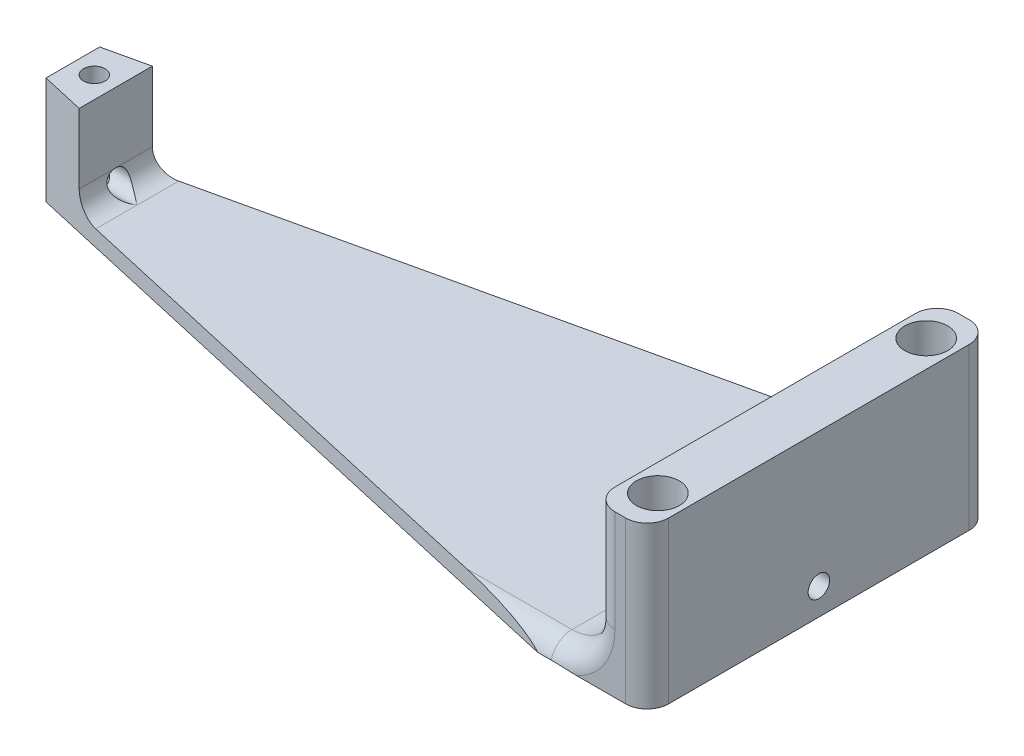
from build123d import *

# Parameters (mm, degrees)
BOSS_EXTRUDE1_DEPTH     = 16
CUT_EXTRUDE1_DEPTH      = 71.973586636
CUT_EXTRUDE1_DEPTH_BACK = 71.973586636
SKETCH2_R               = 2
SKETCH3_R               = 1
CUT_EXTRUDE2_DEPTH      = 8.5
FILLET4_R               = 4
CUT_EXTRUDE3_DEPTH      = 70.074235428
CUT_EXTRUDE3_DEPTH_BACK = 70.074235428
SKETCH4_R               = 1
CUT_EXTRUDE4_DEPTH      = 71.671776663
CUT_EXTRUDE4_DEPTH_BACK = 71.671776663
FILLET1_R               = 2


with BuildPart() as part:
    # Sketch1 → Boss-Extrude1 (new, symmetric)
    with BuildSketch(Plane.XY):
        Polygon((-2, 10), (-2, 0), (67.5, 0), (67.5, 15), (62.5, 15), (62.5, 1.5), (2, 1.5), (2, 10), align=None)
    extrude(amount=BOSS_EXTRUDE1_DEPTH, both=True)

    # Sketch2 → Cut-Extrude1 (cut, two sides: drawn at the far end of the back side and taken through both)
    with BuildSketch(Plane(origin=(0, 15, 0), x_dir=(1, 0, 0), z_dir=(0, 1, 0)).offset(-CUT_EXTRUDE1_DEPTH_BACK)):
        with Locations(Location((65, 12.5, 0), (0, 0, 270))):
            Circle(SKETCH2_R)
        with Locations(Location((65, -12.5, 0), (0, 0, 90))):
            Circle(SKETCH2_R)
    extrude(amount=CUT_EXTRUDE1_DEPTH + CUT_EXTRUDE1_DEPTH_BACK, mode=Mode.SUBTRACT)

    # Sketch3 → Cut-Extrude2 (cut)
    with BuildSketch(Plane(origin=(0, 10, 0), x_dir=(1, 0, 0), z_dir=(0, 1, 0))):
        with Locations(Location((0, 0, 0), (0, 0, 180))):
            Circle(SKETCH3_R)
    extrude(amount=-CUT_EXTRUDE2_DEPTH, mode=Mode.SUBTRACT)

    # Fillet4
    fillet4_edges = [part.edges().sort_by_distance(p)[0] for p in [
        (62.5, 1.5, 0),
    ]]
    fillet(fillet4_edges, radius=FILLET4_R)

    # Sketch4 → Cut-Extrude3 (cut, two sides: drawn at the far end of the back side and taken through both)
    with BuildSketch(Plane(origin=(2, 0, 0), x_dir=(0, 0, -1), z_dir=(1, 0, 0)).offset(-CUT_EXTRUDE3_DEPTH_BACK)):
        with Locations(Location((0, 2.5, 0), (0, 0, 90))):
            Circle(SKETCH4_R)
    extrude(amount=CUT_EXTRUDE3_DEPTH + CUT_EXTRUDE3_DEPTH_BACK, mode=Mode.SUBTRACT)

    # Sketch5 → Cut-Extrude4 (cut, two sides: drawn at the far end of the back side and taken through both)
    with BuildSketch(Plane(origin=(0, 1.5, 0), x_dir=(1, 0, 0), z_dir=(0, 1, 0)).offset(-CUT_EXTRUDE4_DEPTH_BACK)):
        Polygon((57.5, 16), (-2, 2.5), (-2, 16), align=None)
        Polygon((57.5, -16), (-2, -2.5), (-2, -16), align=None)
    extrude(amount=CUT_EXTRUDE4_DEPTH + CUT_EXTRUDE4_DEPTH_BACK, mode=Mode.SUBTRACT)

    # Fillet1
    # the kernel refuses this fillet: 2 mm, written as the material it adds along each edge
    with BuildSketch(Plane(origin=(2, 1.5, 8.407563025), x_dir=(1, 0, 0), z_dir=(0, 0, -1))) as fillet1_piece_1_section:
        with BuildLine():
            CenterArc((FILLET1_R, -FILLET1_R), FILLET1_R, 90, 90)
            Line((0, -FILLET1_R), (0, 0))
            Line((0, 0), (FILLET1_R, 0))
        make_face()
    fillet1_piece_1 = extrude(amount=8.407563034, mode=Mode.PRIVATE)
    fillet1_piece_1 = split(fillet1_piece_1, bisect_by=Plane(origin=(3.078912021, 1.5, 3.65235819), z_dir=(0.2212668816339037, 0, -0.9752132931272052)), keep=Keep.TOP, mode=Mode.PRIVATE)
    fillet1_piece_1 = fillet1_piece_1 - Plane(origin=(2, 2.5, 0), x_dir=(0, 1, 0), z_dir=(1, 0, 0)) * Cylinder(1, 25, mode=Mode.PRIVATE)
    add(fillet1_piece_1)
    with BuildSketch(Plane(origin=(2, 1.5, -9e-09), x_dir=(1, 0, 0), z_dir=(0, 0, -1))) as fillet1_piece_2_section:
        with BuildLine():
            CenterArc((FILLET1_R, -FILLET1_R), FILLET1_R, 90, 90)
            Line((0, -FILLET1_R), (0, 0))
            Line((0, 0), (FILLET1_R, 0))
        make_face()
    fillet1_piece_2 = extrude(amount=8.407563016, mode=Mode.PRIVATE)
    fillet1_piece_2 = split(fillet1_piece_2, bisect_by=Plane(origin=(1.26470786, 1.5, -3.240732035), z_dir=(0.2212668816339037, 0, 0.9752132931272052)), keep=Keep.TOP, mode=Mode.PRIVATE)
    fillet1_piece_2 = fillet1_piece_2 - Plane(origin=(2, 2.5, 0), x_dir=(0, 1, 0), z_dir=(1, 0, 0)) * Cylinder(1, 25, mode=Mode.PRIVATE)
    add(fillet1_piece_2)
    # the kernel refuses this fillet: 2 mm, written as the material it takes off along each edge
    with BuildSketch(Plane(origin=(67.5, -5, -16), x_dir=(-1, 0, 0), z_dir=(0, 1, 0)), Plane(origin=(67.5, -5, 16), x_dir=(0, 0, -1), z_dir=(0, 1, 0))) as fillet1_2_piece_1:
        with BuildLine():
            CenterArc((FILLET1_R, FILLET1_R), FILLET1_R, 180, 90)
            Line((0, FILLET1_R), (0, 0))
            Line((0, 0), (FILLET1_R, 0))
        make_face()
    extrude(amount=25, mode=Mode.SUBTRACT)
    with BuildSketch(Plane(origin=(62.5, 20, -16), x_dir=(1, 0, 0), z_dir=(0, -1, 0)), Plane(origin=(62.5, 20, 16), x_dir=(0, 0, -1), z_dir=(0, -1, 0))) as fillet1_2_piece_2:
        with BuildLine():
            CenterArc((FILLET1_R, FILLET1_R), FILLET1_R, 180, 90)
            Line((0, FILLET1_R), (0, 0))
            Line((0, 0), (FILLET1_R, 0))
        make_face()
    extrude(amount=14.5, mode=Mode.SUBTRACT)
    with BuildSketch(Plane(origin=(58.5, 1.5, -16), x_dir=(0, -1, 0), z_dir=(-1, 0, 0)), Plane(origin=(58.5, 1.5, 16), x_dir=(0, 0, -1), z_dir=(-1, 0, 0))) as fillet1_2_piece_3:
        with BuildLine():
            CenterArc((FILLET1_R, FILLET1_R), FILLET1_R, 180, 90)
            Line((0, FILLET1_R), (0, 0))
            Line((0, 0), (FILLET1_R, 0))
        make_face()
    extrude(amount=16, mode=Mode.SUBTRACT)
    with BuildSketch(Plane(origin=(58.5, 5.5, -16), x_dir=(1, 0, 0), z_dir=(0, 1, 0))) as fillet1_2_piece_4:
        with BuildLine():
            CenterArc((4 + FILLET1_R, -FILLET1_R), FILLET1_R, 90, 90)
            Line((4, -FILLET1_R), (4, 0))
            Line((4, 0), (4 + FILLET1_R, 0))
        make_face()
    revolve(axis=Axis((58.5, 5.5, -16), (0, 0, -1)), revolution_arc=90, mode=Mode.SUBTRACT)
    with BuildSketch(Plane(origin=(58.5, 5.5, 16), x_dir=(1, 0, 0), z_dir=(0, 1, 0))) as fillet1_2_piece_5:
        with BuildLine():
            CenterArc((4 + FILLET1_R, FILLET1_R), FILLET1_R, 180, 90)
            Line((4 + FILLET1_R, 0), (4, 0))
            Line((4, 0), (4, FILLET1_R))
        make_face()
    revolve(axis=Axis((58.5, 5.5, 16), (0, 0, -1)), revolution_arc=90, mode=Mode.SUBTRACT)


solid = part.part
